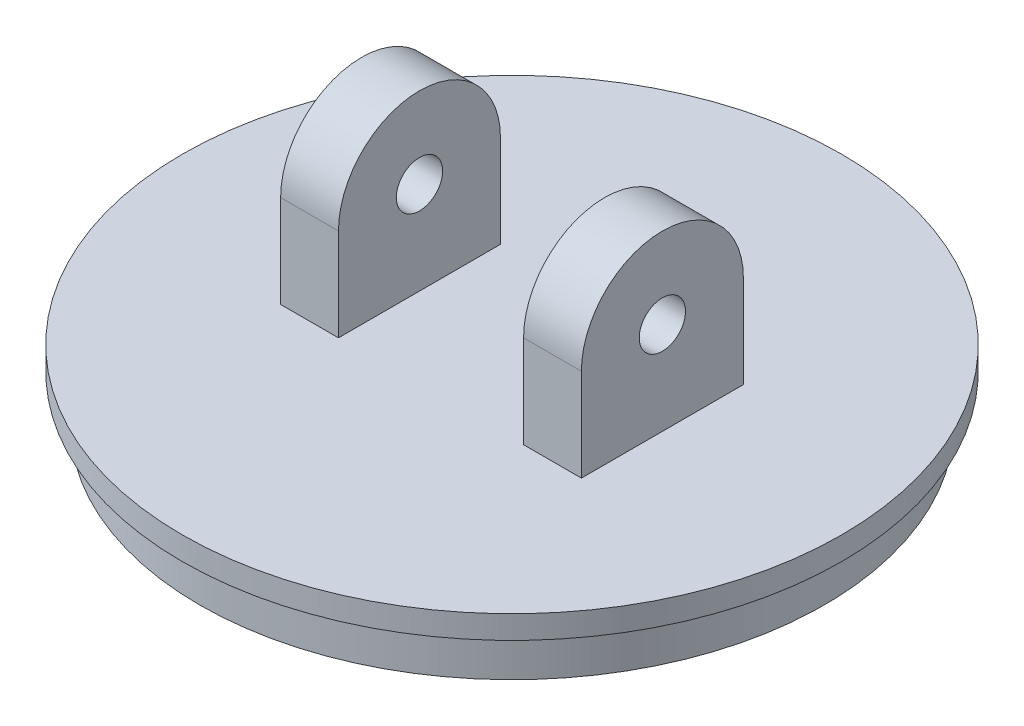
from build123d import *

# Parameters (mm, degrees)
SKETCH1_R           = 135
BOSS_EXTRUDE1_DEPTH = 20
SKETCH3_R           = 142.5
BOSS_EXTRUDE3_DEPTH = 10
SKETCH4_W           = 25
SKETCH4_H           = 70
BOSS_EXTRUDE4_DEPTH = 80
CUT_EXTRUDE1_START  = -130
CUT_EXTRUDE1_DEPTH  = 130
SKETCH6_R           = 10
CUT_EXTRUDE2_DEPTH  = 273.740719365


# Read off the part's stored shape, not the designer's step: Cut-Extrude1
with BuildPart() as part:
    # Sketch1 → Boss-Extrude1 (new body)
    with BuildSketch(Plane(origin=(0, 0, 0), x_dir=(1, 0, 0), z_dir=(0, 1, 0))):
        with Locations(Location((0, 0, 0), (0, 0, 270))):
            Circle(SKETCH1_R)
    extrude(amount=BOSS_EXTRUDE1_DEPTH)

    # Sketch3 → Boss-Extrude3 (add)
    with BuildSketch(Plane(origin=(0, 20, 0), x_dir=(1, 0, 0), z_dir=(0, 1, 0))):
        with Locations(Location((0, 0, 0), (0, 0, 270))):
            Circle(SKETCH3_R)
    extrude(amount=BOSS_EXTRUDE3_DEPTH)

    # Sketch4 → Boss-Extrude4 (add)
    with BuildSketch(Plane(origin=(0, 30, 0), x_dir=(1, 0, 0), z_dir=(0, 1, 0))):
        with Locations((-52.5, 0)):
            Rectangle(SKETCH4_W, SKETCH4_H)
        with Locations((52.5, 0)):
            Rectangle(SKETCH4_W, SKETCH4_H)
    extrude(amount=BOSS_EXTRUDE4_DEPTH)

    # Cut-Extrude1 outline → Cut-Extrude1 (cut)
    with BuildSketch(Plane(origin=(65, 0, 0), x_dir=(0, 0, -1), z_dir=(1, 0, 0)).offset(CUT_EXTRUDE1_START)):
        with BuildLine():
            ThreePointArc((-35, 70), (0, 105), (35, 70))
            Line((35, 70), (35, 110))
            Line((35, 110), (-35, 110))
            Line((-35, 110), (-35, 70))
        make_face()
    extrude(amount=CUT_EXTRUDE1_DEPTH, mode=Mode.SUBTRACT)

    # Sketch6 → Cut-Extrude2 (cut, through all)
    with BuildSketch(Plane(origin=(65, 0, 0), x_dir=(0, 0, -1), z_dir=(1, 0, 0))):
        with Locations((0, 70)):
            Circle(SKETCH6_R)
    extrude(amount=-CUT_EXTRUDE2_DEPTH, mode=Mode.SUBTRACT)


solid = part.part
